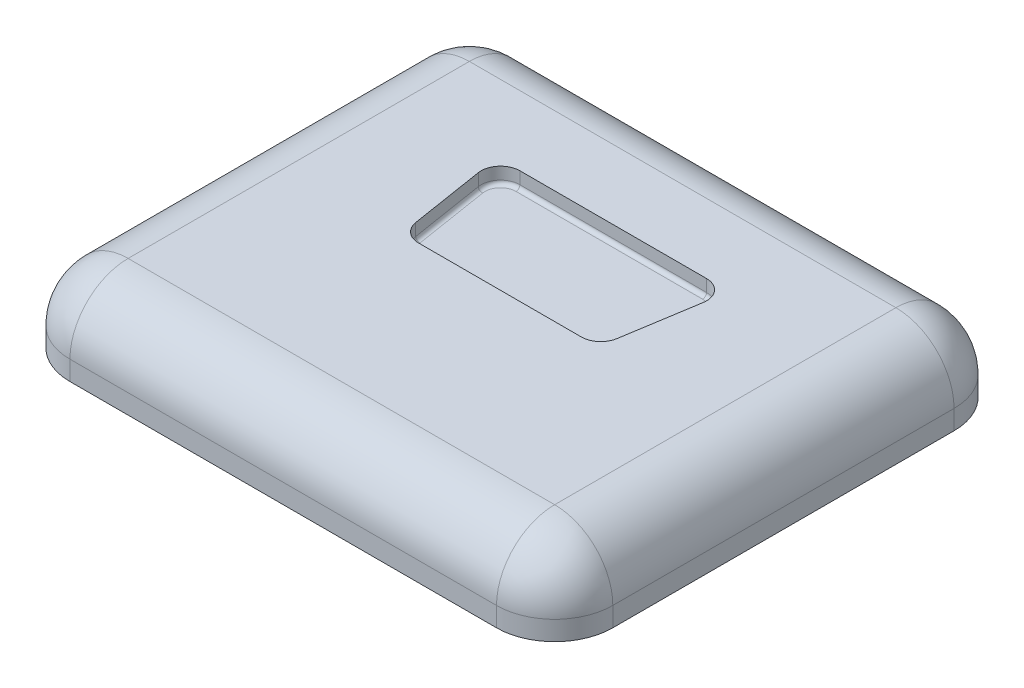
from build123d import *

# Parameters (mm, degrees)
SKETCH1_W           = 280
SKETCH1_H           = 236
BOSS_EXTRUDE1_DEPTH = 40
FILLET1_R           = 30
CUT_EXTRUDE2_DEPTH  = 8.25
FILLET2_R           = 2


with BuildPart() as part:
    # Sketch1 → Boss-Extrude1 (new body)
    with BuildSketch(Plane(origin=(0, 0, 0), x_dir=(1, 0, 0), z_dir=(0, 1, 0))):
        with Locations((27.44, -35.06)):
            Rectangle(SKETCH1_W, SKETCH1_H)
    extrude(amount=BOSS_EXTRUDE1_DEPTH)

    # Fillet1
    fillet1_edges = [part.edges().sort_by_distance(p)[0] for p in [
        (27.44, 40, -82.94),
        (167.44, 40, 35.06),
        (27.44, 40, 153.06),
        (-112.56, 40, 35.06),
        (167.44, 20, -82.94),
        (-112.56, 20, -82.94),
        (-112.56, 20, 153.06),
        (167.44, 20, 153.06),
    ]]
    fillet(fillet1_edges, radius=FILLET1_R)

    # Sketch3 → Cut-Extrude2 (cut)
    with BuildSketch(Plane(origin=(0, 40, 0), x_dir=(1, 0, 0), z_dir=(0, 1, 0))):
        with BuildLine():
            Line((-20.684825583, 17.14), (75.564825583, 17.14))
            ThreePointArc((75.564825583, 17.14), (83.172419453, 13.630340169), (85.44, 5.564903101))
            Line((85.44, 5.564903101), (79.315174417, -32.835096899))
            ThreePointArc((79.315174417, -32.835096899), (75.930340169, -38.86759387), (69.44, -41.26))
            Line((69.44, -41.26), (-14.56, -41.26))
            ThreePointArc((-14.56, -41.26), (-21.050340169, -38.86759387), (-24.435174417, -32.835096899))
            Line((-24.435174417, -32.835096899), (-30.56, 5.564903101))
            ThreePointArc((-30.56, 5.564903101), (-28.292419453, 13.630340169), (-20.684825583, 17.14))
        make_face()
    extrude(amount=-CUT_EXTRUDE2_DEPTH, mode=Mode.SUBTRACT)

    # Fillet2
    fillet2_edges = [part.edges().sort_by_distance(p)[0] for p in [
        (-27.497587208, 31.75, 13.635096899),
        (-28.292419453, 31.75, -13.630340169),
        (27.44, 31.75, -17.14),
        (83.172419453, 31.75, -13.630340169),
        (82.377587208, 31.75, 13.635096899),
        (75.930340169, 31.75, 38.86759387),
        (27.44, 31.75, 41.26),
        (-21.050340169, 31.75, 38.86759387),
    ]]
    fillet(fillet2_edges, radius=FILLET2_R)


solid = part.part
